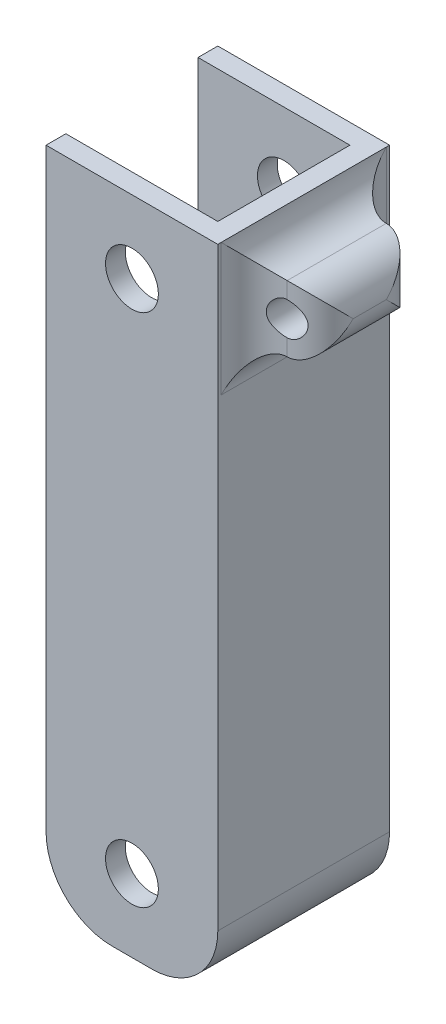
from build123d import *

# Parameters (mm, degrees)
SKETCH1_W               = 26
SKETCH1_H               = 100
BOSS_EXTRUDE1_DEPTH     = 13
FILLET1_R               = 10
SKETCH5_W               = 10
SKETCH5_H               = 10
SKETCH5_R               = 2.5
BOSS_EXTRUDE3_DEPTH     = 7.5
FILLET2_R               = 5
CUT_EXTRUDE1_DEPTH      = 104.431136533
CUT_EXTRUDE1_DEPTH_BACK = 104.431136533
SKETCH6_W               = 23
SKETCH6_H               = 20
CUT_EXTRUDE2_DEPTH      = 104.43113663
CUT_EXTRUDE2_DEPTH_BACK = 104.43113663
SKETCH3_R               = 4


with BuildPart() as part:
    # Sketch1 → Boss-Extrude1 (new, symmetric)
    with BuildSketch(Plane(origin=(0, 0, 0), x_dir=(0, 0, -1), z_dir=(1, 0, 0))):
        with Locations((0, 50)):
            Rectangle(SKETCH1_W, SKETCH1_H)
    extrude(amount=BOSS_EXTRUDE1_DEPTH, both=True)

    # Fillet1
    fillet1_edges = [part.edges().sort_by_distance(p)[0] for p in [
        (-13, 0, 0),
        (13, 0, 0),
    ]]
    fillet(fillet1_edges, radius=FILLET1_R)

    # Sketch5 → Boss-Extrude3 (add, symmetric)
    with BuildSketch(Plane.XY):
        with Locations((18, 90)):
            Rectangle(SKETCH5_W, SKETCH5_H)
        with Locations((18, 90)):
            Circle(SKETCH5_R, mode=Mode.SUBTRACT)
    extrude(amount=BOSS_EXTRUDE3_DEPTH, both=True)

    # Fillet2
    # the kernel refuses this fillet: 5 mm, written as the material it adds along each edge
    with BuildSketch(Plane(origin=(13, 85, 7.5), x_dir=(0, 0, 1), z_dir=(0, 1, 0))) as fillet2_piece_1_section:
        with BuildLine():
            CenterArc((FILLET2_R, FILLET2_R), FILLET2_R, 180, 90)
            Line((0, FILLET2_R), (0, 0))
            Line((0, 0), (FILLET2_R, 0))
        make_face()
    fillet2_piece_1 = extrude(amount=10, mode=Mode.PRIVATE)
    fillet2_piece_1 = fillet2_piece_1 - Plane(origin=(18, 90, 8.676026407), x_dir=(1, 0, 0), z_dir=(0, 0, -1)) * Cylinder(2.5, 41, mode=Mode.PRIVATE)
    add(fillet2_piece_1)
    with BuildSketch(Plane(origin=(13, 85, -7.5), x_dir=(0, 0, -1), z_dir=(0, 1, 0))) as fillet2_piece_2_section:
        with BuildLine():
            CenterArc((FILLET2_R, -FILLET2_R), FILLET2_R, 90, 90)
            Line((0, -FILLET2_R), (0, 0))
            Line((0, 0), (FILLET2_R, 0))
        make_face()
    fillet2_piece_2 = extrude(amount=10, mode=Mode.PRIVATE)
    fillet2_piece_2 = fillet2_piece_2 - Plane(origin=(18, 90, -8.676026407), x_dir=(1, 0, 0), z_dir=(0, 0, -1)) * Cylinder(2.5, 41, mode=Mode.PRIVATE)
    add(fillet2_piece_2)
    with BuildSketch(Plane(origin=(13, 95, -7.5), x_dir=(0, 1, 0), z_dir=(0, 0, 1))) as fillet2_piece_3:
        with BuildLine():
            CenterArc((FILLET2_R, -FILLET2_R), FILLET2_R, 90, 90)
            Line((0, -FILLET2_R), (0, 0))
            Line((0, 0), (FILLET2_R, 0))
        make_face()
    extrude(amount=15)
    with BuildSketch(Plane(origin=(13, 85, -7.5), x_dir=(0, -1, 0), z_dir=(0, 0, 1))) as fillet2_piece_4:
        with BuildLine():
            CenterArc((FILLET2_R, FILLET2_R), FILLET2_R, 180, 90)
            Line((0, FILLET2_R), (0, 0))
            Line((0, 0), (FILLET2_R, 0))
        make_face()
    extrude(amount=15)
    with BuildSketch(Plane(origin=(13, 72.5, 7.5), x_dir=(0, 0, 1), z_dir=(0, 1, 0))) as fillet2_piece_5a_section:
        with BuildLine():
            CenterArc((FILLET2_R, FILLET2_R), FILLET2_R, 180, 90)
            Line((0, FILLET2_R), (0, 0))
            Line((0, 0), (FILLET2_R, 0))
        make_face()
    fillet2_piece_5a = extrude(amount=22.5, mode=Mode.PRIVATE)
    fillet2_piece_5a = split(fillet2_piece_5a, bisect_by=Plane(origin=(14.131975571, 85, 8.631975571), z_dir=(0, -1, 0)), keep=Keep.TOP, mode=Mode.PRIVATE)
    with BuildSketch(Plane(origin=(13, 85, -7.5), x_dir=(0, -1, 0), z_dir=(0, 0, 1))) as fillet2_piece_5b_section:
        with BuildLine():
            CenterArc((FILLET2_R, FILLET2_R), FILLET2_R, 180, 90)
            Line((0, FILLET2_R), (0, 0))
            Line((0, 0), (FILLET2_R, 0))
        make_face()
    fillet2_piece_5b = extrude(amount=27.5, mode=Mode.PRIVATE)
    fillet2_piece_5b = split(fillet2_piece_5b, bisect_by=Plane(origin=(14.131975571, 83.868024429, 13), z_dir=(0, 0, -1)), keep=Keep.TOP, mode=Mode.PRIVATE)
    fillet2_piece_5b = split(fillet2_piece_5b, bisect_by=Plane(origin=(14.131975571, 83.868024429, 7.5), z_dir=(0, 0, 1)), keep=Keep.TOP, mode=Mode.PRIVATE)
    fillet2_piece_5 = fillet2_piece_5a & fillet2_piece_5b
    add(fillet2_piece_5)
    with BuildSketch(Plane(origin=(13, 95, -7.5), x_dir=(0, 1, 0), z_dir=(0, 0, 1))) as fillet2_piece_6a_section:
        with BuildLine():
            CenterArc((FILLET2_R, -FILLET2_R), FILLET2_R, 90, 90)
            Line((0, -FILLET2_R), (0, 0))
            Line((0, 0), (FILLET2_R, 0))
        make_face()
    fillet2_piece_6a = extrude(amount=27.5, mode=Mode.PRIVATE)
    fillet2_piece_6a = split(fillet2_piece_6a, bisect_by=Plane(origin=(14.131975571, 96.131975571, 13), z_dir=(0, 0, -1)), keep=Keep.TOP, mode=Mode.PRIVATE)
    fillet2_piece_6a = split(fillet2_piece_6a, bisect_by=Plane(origin=(14.131975571, 96.131975571, 7.5), z_dir=(0, 0, 1)), keep=Keep.TOP, mode=Mode.PRIVATE)
    with BuildSketch(Plane(origin=(13, 85, 7.5), x_dir=(0, 0, 1), z_dir=(0, 1, 0))) as fillet2_piece_6b_section:
        with BuildLine():
            CenterArc((FILLET2_R, FILLET2_R), FILLET2_R, 180, 90)
            Line((0, FILLET2_R), (0, 0))
            Line((0, 0), (FILLET2_R, 0))
        make_face()
    fillet2_piece_6b = extrude(amount=22.5, mode=Mode.PRIVATE)
    fillet2_piece_6b = split(fillet2_piece_6b, bisect_by=Plane(origin=(14.131975571, 100, 8.631975571), z_dir=(0, -1, 0)), keep=Keep.TOP, mode=Mode.PRIVATE)
    fillet2_piece_6b = split(fillet2_piece_6b, bisect_by=Plane(origin=(14.131975571, 95, 8.631975571), z_dir=(0, 1, 0)), keep=Keep.TOP, mode=Mode.PRIVATE)
    fillet2_piece_6 = fillet2_piece_6a & fillet2_piece_6b
    add(fillet2_piece_6)
    with BuildSketch(Plane(origin=(13, 85, -20), x_dir=(0, -1, 0), z_dir=(0, 0, 1))) as fillet2_piece_7a_section:
        with BuildLine():
            CenterArc((FILLET2_R, FILLET2_R), FILLET2_R, 180, 90)
            Line((0, FILLET2_R), (0, 0))
            Line((0, 0), (FILLET2_R, 0))
        make_face()
    fillet2_piece_7a = extrude(amount=27.5, mode=Mode.PRIVATE)
    fillet2_piece_7a = split(fillet2_piece_7a, bisect_by=Plane(origin=(14.131975571, 83.868024429, -13), z_dir=(0, 0, 1)), keep=Keep.TOP, mode=Mode.PRIVATE)
    fillet2_piece_7a = split(fillet2_piece_7a, bisect_by=Plane(origin=(14.131975571, 83.868024429, -7.5), z_dir=(0, 0, -1)), keep=Keep.TOP, mode=Mode.PRIVATE)
    with BuildSketch(Plane(origin=(13, 72.5, -7.5), x_dir=(0, 0, -1), z_dir=(0, 1, 0))) as fillet2_piece_7b_section:
        with BuildLine():
            CenterArc((FILLET2_R, -FILLET2_R), FILLET2_R, 90, 90)
            Line((0, -FILLET2_R), (0, 0))
            Line((0, 0), (FILLET2_R, 0))
        make_face()
    fillet2_piece_7b = extrude(amount=22.5, mode=Mode.PRIVATE)
    fillet2_piece_7b = split(fillet2_piece_7b, bisect_by=Plane(origin=(14.131975571, 85, -8.631975571), z_dir=(0, -1, 0)), keep=Keep.TOP, mode=Mode.PRIVATE)
    fillet2_piece_7 = fillet2_piece_7a & fillet2_piece_7b
    add(fillet2_piece_7)
    with BuildSketch(Plane(origin=(13, 95, -20), x_dir=(0, 1, 0), z_dir=(0, 0, 1))) as fillet2_piece_8a_section:
        with BuildLine():
            CenterArc((FILLET2_R, -FILLET2_R), FILLET2_R, 90, 90)
            Line((0, -FILLET2_R), (0, 0))
            Line((0, 0), (FILLET2_R, 0))
        make_face()
    fillet2_piece_8a = extrude(amount=27.5, mode=Mode.PRIVATE)
    fillet2_piece_8a = split(fillet2_piece_8a, bisect_by=Plane(origin=(14.131975571, 96.131975571, -13), z_dir=(0, 0, 1)), keep=Keep.TOP, mode=Mode.PRIVATE)
    fillet2_piece_8a = split(fillet2_piece_8a, bisect_by=Plane(origin=(14.131975571, 96.131975571, -7.5), z_dir=(0, 0, -1)), keep=Keep.TOP, mode=Mode.PRIVATE)
    with BuildSketch(Plane(origin=(13, 85, -7.5), x_dir=(0, 0, -1), z_dir=(0, 1, 0))) as fillet2_piece_8b_section:
        with BuildLine():
            CenterArc((FILLET2_R, -FILLET2_R), FILLET2_R, 90, 90)
            Line((0, -FILLET2_R), (0, 0))
            Line((0, 0), (FILLET2_R, 0))
        make_face()
    fillet2_piece_8b = extrude(amount=22.5, mode=Mode.PRIVATE)
    fillet2_piece_8b = split(fillet2_piece_8b, bisect_by=Plane(origin=(14.131975571, 100, -8.631975571), z_dir=(0, -1, 0)), keep=Keep.TOP, mode=Mode.PRIVATE)
    fillet2_piece_8b = split(fillet2_piece_8b, bisect_by=Plane(origin=(14.131975571, 95, -8.631975571), z_dir=(0, 1, 0)), keep=Keep.TOP, mode=Mode.PRIVATE)
    fillet2_piece_8 = fillet2_piece_8a & fillet2_piece_8b
    add(fillet2_piece_8)
    # the kernel refuses this fillet: 5 mm, written as the material it takes off along each edge
    with BuildSketch(Plane(origin=(23, 107.5, -7.5), x_dir=(-1, 0, 0), z_dir=(0, -1, 0)), Plane(origin=(23, 107.5, 7.5), x_dir=(0, 0, -1), z_dir=(0, -1, 0))) as fillet2_2_piece_1:
        with BuildLine():
            CenterArc((FILLET2_R, -FILLET2_R), FILLET2_R, 90, 90)
            Line((0, -FILLET2_R), (0, 0))
            Line((0, 0), (FILLET2_R, 0))
        make_face()
    extrude(amount=35, mode=Mode.SUBTRACT)
    with BuildSketch(Plane(origin=(23, 95, 20), x_dir=(-1, 0, 0), z_dir=(0, 0, -1)), Plane(origin=(23, 85, 20), x_dir=(0, 1, 0), z_dir=(0, 0, -1))) as fillet2_2_piece_2:
        with BuildLine():
            CenterArc((FILLET2_R, -FILLET2_R), FILLET2_R, 90, 90)
            Line((0, -FILLET2_R), (0, 0))
            Line((0, 0), (FILLET2_R, 0))
        make_face()
    extrude(amount=40, mode=Mode.SUBTRACT)

    # Sketch6 → Cut-Extrude1 (cut, two sides: drawn at the far end of the back side and taken through both)
    with BuildSketch(Plane(origin=(0, 100, 0), x_dir=(1, 0, 0), z_dir=(0, 1, 0)).offset(-CUT_EXTRUDE1_DEPTH_BACK)):
        with Locations((-1.5, 0)):
            Rectangle(SKETCH6_W, SKETCH6_H)
    extrude(amount=CUT_EXTRUDE1_DEPTH + CUT_EXTRUDE1_DEPTH_BACK, mode=Mode.SUBTRACT)

    # Sketch3 → Cut-Extrude2 (cut, two sides: drawn at the far end of the back side and taken through both)
    with BuildSketch(Plane.XY.offset(-CUT_EXTRUDE2_DEPTH_BACK)):
        with Locations((0, 11)):
            Circle(SKETCH3_R)
        with Locations((0, 89)):
            Circle(SKETCH3_R)
    extrude(amount=CUT_EXTRUDE2_DEPTH + CUT_EXTRUDE2_DEPTH_BACK, mode=Mode.SUBTRACT)


solid = part.part
